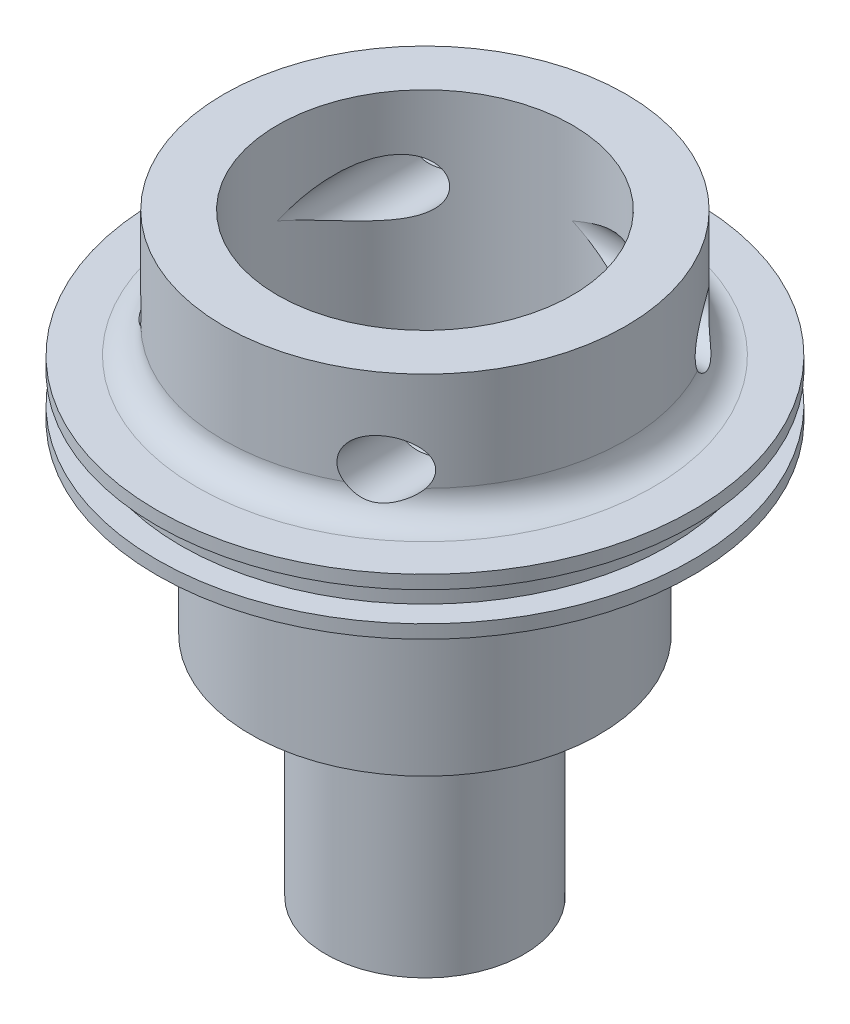
from build123d import *

# Parameters (mm, degrees)
SKETCH1_R                = 32.385
STEEL_CYLINDER_DEPTH     = 56.388
SKETCH3_R                = 32.385
SKETCH3_R_2              = 25.4
BOTTOM_CUT_BIG_DEPTH     = 44.45
SKETCH2_R                = 25.4
SKETCH2_R_2              = 9.398
BOTTOM_CUT_STEM_DEPTH    = 21.59
TOP_START                = -11.938
SKETCH4_R                = 32.385
SKETCH4_R_2              = 19.05
TOP_CUT_DEPTH            = 11.938
STEM_INNER_REACH         = 68.858
SKETCH5_R                = 6.35
SKETCH6_R                = 13.97
TOP_INNER_DEPTH          = 27.178
SKETCH7_W                = 2.286
SKETCH7_H                = 2.794
TOP_FILLET_R             = 2.5654
SKETCH8_W                = 2.286
SKETCH8_H                = 17.526
INTLET_HOLE_REACH        = 68.858
SKETCH10_R               = 2.667
INLET_PATTERN_COUNT      = 4
INNER_CHAMFER_SIZE       = 7.62
SKETCH11_R               = 23.114
SKETCH11_R_2             = 16.51
MIDDLE_OUTER_CUT_2_DEPTH = 16.002


with BuildPart() as part:
    # Sketch1 → Steel Cylinder (new body)
    with BuildSketch(Plane(origin=(0, 0, 0), x_dir=(1, 0, 0), z_dir=(0, 1, 0))):
        with Locations(Location((0, 0, 0), (0, 0, 270))):
            Circle(SKETCH1_R)
    extrude(amount=STEEL_CYLINDER_DEPTH)

    # Sketch3 → Bottom Cut Big (cut)
    with BuildSketch(Plane.XZ):
        with Locations(Location((0, 0, 0), (0, 0, 270))):
            Circle(SKETCH3_R)
        with Locations(Location((0, 0, 0), (0, 0, 270))):
            Circle(SKETCH3_R_2, mode=Mode.SUBTRACT)
    extrude(amount=-BOTTOM_CUT_BIG_DEPTH, mode=Mode.SUBTRACT)

    # Sketch2 → Bottom Cut Stem (cut)
    with BuildSketch(Plane.XZ):
        with Locations(Location((0, 0, 0), (0, 0, 270))):
            Circle(SKETCH2_R)
        with Locations(Location((0, 0, 0), (0, 0, 270))):
            Circle(SKETCH2_R_2, mode=Mode.SUBTRACT)
    extrude(amount=-BOTTOM_CUT_STEM_DEPTH, mode=Mode.SUBTRACT)

    # Sketch4 → Top Cut (cut)
    with BuildSketch(Plane(origin=(0, 56.388, 0), x_dir=(1, 0, 0), z_dir=(0, 1, 0)).offset(TOP_START)):
        Circle(SKETCH4_R)
        with Locations(Location((0, 0, 0), (0, 0, 270))):
            Circle(SKETCH4_R_2, mode=Mode.SUBTRACT)
    extrude(amount=TOP_CUT_DEPTH, mode=Mode.SUBTRACT)

    # Sketch5 → Stem Inner (cut, up to next)
    with BuildSketch(Plane.XZ, mode=Mode.PRIVATE) as stem_inner_sk1:
        with Locations(Location((0, 0, 0), (0, 0, 270))):
            Circle(SKETCH5_R)
    stem_inner_tool1 = extrude(stem_inner_sk1.sketch, amount=-STEM_INNER_REACH, mode=Mode.PRIVATE) & part.part
    add(stem_inner_tool1.solids().sort_by_distance((0, 0, 0))[0], mode=Mode.SUBTRACT)

    # Sketch6 → Top Inner (cut)
    with BuildSketch(Plane(origin=(0, 56.388, 0), x_dir=(1, 0, 0), z_dir=(0, 1, 0))):
        with Locations(Location((0, 0, 0), (0, 0, 270))):
            Circle(SKETCH6_R)
    extrude(amount=-TOP_INNER_DEPTH, mode=Mode.SUBTRACT)

    # Sketch7 → O Ring (revolve, cut)
    with BuildSketch(Plane.XY, mode=Mode.PRIVATE) as o_ring_sk:
        with Locations((24.257, 41.783)):
            Rectangle(SKETCH7_W, SKETCH7_H)
    revolve(o_ring_sk.sketch.rotate(Axis((0, 67.055012984, 0), (0, -1, 0)), 90), axis=Axis((0, 67.055012984, 0), (0, -1, 0)), mode=Mode.SUBTRACT)

    # Top Fillet
    top_fillet_edges = [part.edges().sort_by_distance(p)[0] for p in [
        (0, 44.45, -19.05),
    ]]
    fillet(top_fillet_edges, radius=TOP_FILLET_R)

    # Sketch8 → Based O Ring Cut (revolve, cut)
    with BuildSketch(Plane.XY, mode=Mode.PRIVATE) as based_o_ring_cut_sk:
        with Locations((24.257, 30.353)):
            Rectangle(SKETCH8_W, SKETCH8_H)
    revolve(based_o_ring_cut_sk.sketch.rotate(Axis((0, 67.055012984, 0), (0, -1, 0)), 90), axis=Axis((0, 67.055012984, 0), (0, -1, 0)), mode=Mode.SUBTRACT)

    # Sketch10 → Intlet Hole (cut, up to next)
    with BuildSketch(Plane.XY, mode=Mode.PRIVATE) as intlet_hole_sk1:
        with Locations(Location((11.303, 48.514, 0), (0, 0, 214.187627302))):
            Circle(SKETCH10_R)
    intlet_hole_tool1 = extrude(intlet_hole_sk1.sketch, amount=INTLET_HOLE_REACH, mode=Mode.PRIVATE) & part.part
    intlet_hole = intlet_hole_tool1.solids().sort_by_distance((11.303, 48.514, 0))[0]
    add(intlet_hole, mode=Mode.SUBTRACT)

    # Inlet Pattern: Intlet Hole ×4 about axis
    inlet_pattern_axis = Axis((0, 67.055012984, 0), (0, -1, 0))
    for i in range(1, INLET_PATTERN_COUNT):
        add(intlet_hole.rotate(inlet_pattern_axis, i * 360 / INLET_PATTERN_COUNT), mode=Mode.SUBTRACT)

    # Inner Chamfer
    inner_chamfer_edges = [part.edges().sort_by_distance(p)[0] for p in [
        (0, 29.21, 6.35),
    ]]
    chamfer(inner_chamfer_edges, length=INNER_CHAMFER_SIZE - 0.0001)  # a hair under: the kernel refuses the full size

    # Sketch11 → Middle Outer Cut 2 (cut)
    with BuildSketch(Plane.XZ.offset(-21.59)):
        with Locations(Location((0, 0, 0), (0, 0, 90))):
            Circle(SKETCH11_R)
        with Locations(Location((0, 0, 0), (0, 0, 270))):
            Circle(SKETCH11_R_2, mode=Mode.SUBTRACT)
    extrude(amount=-MIDDLE_OUTER_CUT_2_DEPTH, mode=Mode.SUBTRACT)


solid = part.part
